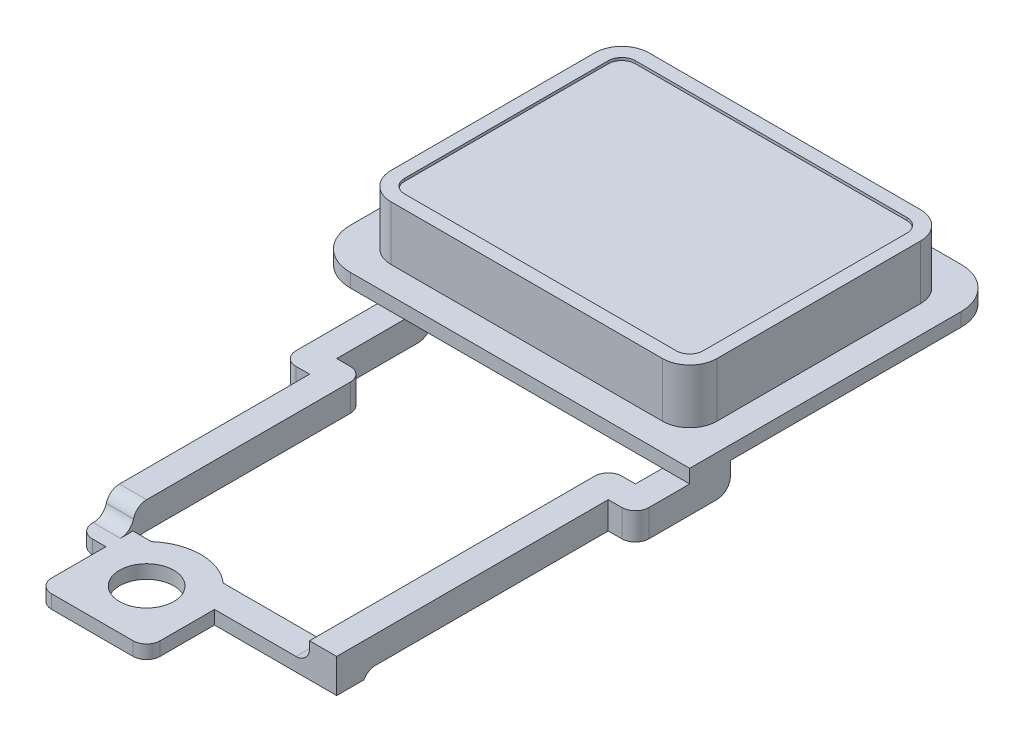
from build123d import *

# Parameters (mm, degrees)
SKETCH1_W                = 12
SKETCH1_H                = 9.5
BOSS_EXTRUDE1_DEPTH      = 2
SKETCH2_W                = 11
SKETCH2_H                = 8.5
CUT_EXTRUDE1_DEPTH       = 0.1
FILLET1_R                = 0.5
FILLET2_R                = 1
SKETCH3_W                = 14
SKETCH3_H                = 11.5
BOSS_EXTRUDE2_DEPTH      = 0.5
BOSS_EXTRUDE5_DEPTH      = 1
BOSS_EXTRUDE6_DEPTH      = 0.25
BOSS_EXTRUDE6_DEPTH_BACK = 0.25
SKETCH7_W                = 9.5
SKETCH7_H                = 1
BOSS_EXTRUDE7_DEPTH      = 0.5
CUT_EXTRUDE2_REACH       = 22.489
SKETCH10_R               = 1
FILLET4_R                = 0.5
FILLET5_R                = 0.5
FILLET6_R                = 1.5
SKETCH11_W               = 10.5
SKETCH11_H               = 7.5
CUT_EXTRUDE3_DEPTH       = 0.3
FILLET7_R                = 0.3


with BuildPart() as part:
    # Sketch1 → Boss-Extrude1 (new body)
    with BuildSketch(Plane(origin=(0, 0, 0), x_dir=(1, 0, 0), z_dir=(0, 1, 0))):
        with Locations((6, 4.75)):
            Rectangle(SKETCH1_W, SKETCH1_H)
    extrude(amount=BOSS_EXTRUDE1_DEPTH)

    # Sketch2 → Cut-Extrude1 (cut)
    with BuildSketch(Plane(origin=(0, 2, 0), x_dir=(1, 0, 0), z_dir=(0, 1, 0))):
        with Locations((6, 4.75)):
            Rectangle(SKETCH2_W, SKETCH2_H)
    extrude(amount=-CUT_EXTRUDE1_DEPTH, mode=Mode.SUBTRACT)

    # Fillet1
    fillet1_edges = [part.edges().sort_by_distance(p)[0] for p in [
        (0.5, 1.95, -0.5),
        (0.5, 1.95, -9),
        (11.5, 1.95, -9),
        (11.5, 1.95, -0.5),
    ]]
    fillet(fillet1_edges, radius=FILLET1_R)

    # Fillet2
    fillet2_edges = [part.edges().sort_by_distance(p)[0] for p in [
        (0, 1, -9.5),
        (12, 1, -9.5),
        (12, 1, 0),
        (0, 1, 0),
    ]]
    fillet(fillet2_edges, radius=FILLET2_R)

    # Sketch3 → Boss-Extrude2 (add)
    with BuildSketch(Plane.XZ):
        with Locations((6, -4.75)):
            Rectangle(SKETCH3_W, SKETCH3_H)
    extrude(amount=BOSS_EXTRUDE2_DEPTH)

    # Sketch6 → Boss-Extrude5 (add)
    with BuildSketch(Plane.XZ.offset(0.5)):
        Polygon((13, -0.5), (12, -0.5), (12, 2), (11, 2), (11, 13), (12, 13), (12, 3), (13, 3), align=None)
        Polygon((3.5, 12), (2.5, 12), (2.5, 4.5), (1.5, 4.5), (1.5, 0), (2.5, 0), (2.5, 3.5), (3.5, 3.5), align=None)
    extrude(amount=BOSS_EXTRUDE5_DEPTH)

    # Sketch7 → Boss-Extrude6 (add, two sides: drawn at the far end of the back side and taken through both)
    with BuildSketch(Plane.XZ.offset(1.5).offset(-BOSS_EXTRUDE6_DEPTH_BACK)):
        with Locations((7.25, 12.5)):
            Rectangle(SKETCH7_W, SKETCH7_H)
    extrude(amount=BOSS_EXTRUDE6_DEPTH + BOSS_EXTRUDE6_DEPTH_BACK)

    # Sketch9 → Boss-Extrude7 (add)
    with BuildSketch(Plane(origin=(0, -1.25, 0), x_dir=(1, 0, 0), z_dir=(0, 1, 0))):
        with BuildLine():
            Line((6.822875656, -12), (7.5, -12))
            Line((7.5, -12), (7.5, -15.5))
            Line((7.5, -15.5), (3.5, -15.5))
            Line((3.5, -15.5), (3.5, -12))
            Line((3.5, -12), (4.177124344, -12))
            ThreePointArc((4.177124344, -12), (5.5, -11.5), (6.822875656, -12))
        make_face()
    extrude(amount=-BOSS_EXTRUDE7_DEPTH)

    # Sketch10 → Cut-Extrude2 (cut, up to next)
    with BuildSketch(Plane(origin=(0, -1.25, 0), x_dir=(1, 0, 0), z_dir=(0, 1, 0)), mode=Mode.PRIVATE) as cut_extrude2_sk1:
        with Locations(Location((5.5, -13.5, 0), (0, 0, 270))):
            Circle(SKETCH10_R)
    cut_extrude2_tool1 = extrude(cut_extrude2_sk1.sketch, amount=-CUT_EXTRUDE2_REACH, mode=Mode.PRIVATE) & part.part
    add(cut_extrude2_tool1.solids().sort_by_distance((5.5, -1.25, 13.5))[0], mode=Mode.SUBTRACT)

    # Fillet4
    # the kernel refuses this fillet: 0.5 mm, written as the material it adds along each edge
    with BuildSketch(Plane(origin=(11, -1.25, 13), x_dir=(0, 1, 0), z_dir=(0, 0, -1))) as fillet4_piece_1:
        with BuildLine():
            CenterArc((FILLET4_R, -FILLET4_R), FILLET4_R, 90, 90)
            Line((0, -FILLET4_R), (0, 0))
            Line((0, 0), (FILLET4_R, 0))
        make_face()
    extrude(amount=1)
    with BuildSketch(Plane(origin=(3.5, -1.5, 12), x_dir=(0, 0, -1), z_dir=(-1, 0, 0))) as fillet4_piece_2:
        with BuildLine():
            CenterArc((0.433012702, 0.5), FILLET4_R, 210, 60)
            Line((0, 0.25), (0, 0))
            Line((0, 0), (0.433012702, 0))
        make_face()
    extrude(amount=1)
    # the kernel refuses this fillet: 0.5 mm, written as the material it takes off along each edge
    with BuildSketch(Plane(origin=(13, 0.75, 3), x_dir=(-1, 0, 0), z_dir=(0, -1, 0)), Plane(origin=(11, 0.75, 2), x_dir=(1, 0, 0), z_dir=(0, -1, 0)), Plane(origin=(14.25, -1.5, -0.5), x_dir=(0, 0, 1), z_dir=(-1, 0, 0)), Plane(origin=(3.5, 0.75, 3.5), x_dir=(0, 0, 1), z_dir=(0, -1, 0))) as fillet4_2_piece_1:
        with BuildLine():
            CenterArc((FILLET4_R, FILLET4_R), FILLET4_R, 180, 90)
            Line((0, FILLET4_R), (0, 0))
            Line((0, 0), (FILLET4_R, 0))
        make_face()
    extrude(amount=3.5, mode=Mode.SUBTRACT)
    with BuildSketch(Plane(origin=(4.75, -0.5, 12), x_dir=(0, -1, 0), z_dir=(-1, 0, 0)), Plane(origin=(1.5, 0.75, 4.5), x_dir=(1, 0, 0), z_dir=(0, -1, 0)), Plane(origin=(0.25, -1.5, 0), x_dir=(0, 0, 1), z_dir=(1, 0, 0))) as fillet4_2_piece_2:
        with BuildLine():
            CenterArc((FILLET4_R, -FILLET4_R), FILLET4_R, 90, 90)
            Line((0, -FILLET4_R), (0, 0))
            Line((0, 0), (FILLET4_R, 0))
        make_face()
    extrude(amount=3.5, mode=Mode.SUBTRACT)
    with BuildSketch(Plane(origin=(2.5, 0, 13), x_dir=(0, 0, -1), z_dir=(0, -1, 0)), Plane(origin=(3.5, 0, 15.5), x_dir=(0, 0, -1), z_dir=(0, -1, 0)), Plane(origin=(7.5, 0, 15.5), x_dir=(-1, 0, 0), z_dir=(0, -1, 0))) as fillet4_2_piece_3:
        with BuildLine():
            CenterArc((FILLET4_R, FILLET4_R), FILLET4_R, 180, 90)
            Line((0, FILLET4_R), (0, 0))
            Line((0, 0), (FILLET4_R, 0))
        make_face()
    extrude(amount=3, mode=Mode.SUBTRACT)

    # Fillet5
    # the kernel refuses this fillet: 0.5 mm, written as the material it adds along each edge
    with BuildSketch(Plane(origin=(3.5, -1.25, 12), x_dir=(0, 0.9991049126334705, -0.04230098759681056), z_dir=(-1, 0, 0))) as fillet5_piece_1:
        with BuildLine():
            CenterArc((0.479745195, -0.488977209), FILLET5_R, 102.053120737, 75.522487814)
            Line((-0.019807261, -0.467826716), (-0.069762507, -0.465711666))
            Line((-0.069762507, -0.465711666), (-0.049955246, 0.002115049))
            Line((-0.049955246, 0.002115049), (0.002115049, 0.049955246))
            ThreePointArc((0.002115049, 0.049955246), (0.251891278, 0.039379999), (0.364895035, 0.048897721))
            Line((0.364895035, 0.048897721), (0.375335958, 0))
        make_face()
    extrude(amount=1)
    with BuildSketch(Plane(origin=(12, -1.5, 12), x_dir=(0, -1, 0), z_dir=(-1, 0, 0))) as fillet5_piece_2:
        with BuildLine():
            CenterArc((0.5, -0.433012702), FILLET5_R, 120, 60)
            Line((0, -0.433012702), (0, 0))
            Line((0, 0), (0.25, 0))
        make_face()
    extrude(amount=1)

    # Fillet6
    fillet6_edges = [part.edges().sort_by_distance(p)[0] for p in [
        (-1, -0.25, 1),
        (-1, -0.25, -10.5),
        (13, -0.25, -10.5),
    ]]
    fillet(fillet6_edges, radius=FILLET6_R)

    # Sketch11 → Cut-Extrude3 (cut)
    with BuildSketch(Plane.XZ.offset(0.5)):
        with Locations((5.75, -4.75)):
            Rectangle(SKETCH11_W, SKETCH11_H)
    extrude(amount=-CUT_EXTRUDE3_DEPTH, mode=Mode.SUBTRACT)

    # Fillet7
    fillet7_edges = [part.edges().sort_by_distance(p)[0] for p in [
        (0.5, -0.35, -8.5),
        (0.5, -0.35, -1),
        (11, -0.35, -1),
        (11, -0.35, -8.5),
    ]]
    fillet(fillet7_edges, radius=FILLET7_R)


solid = part.part
